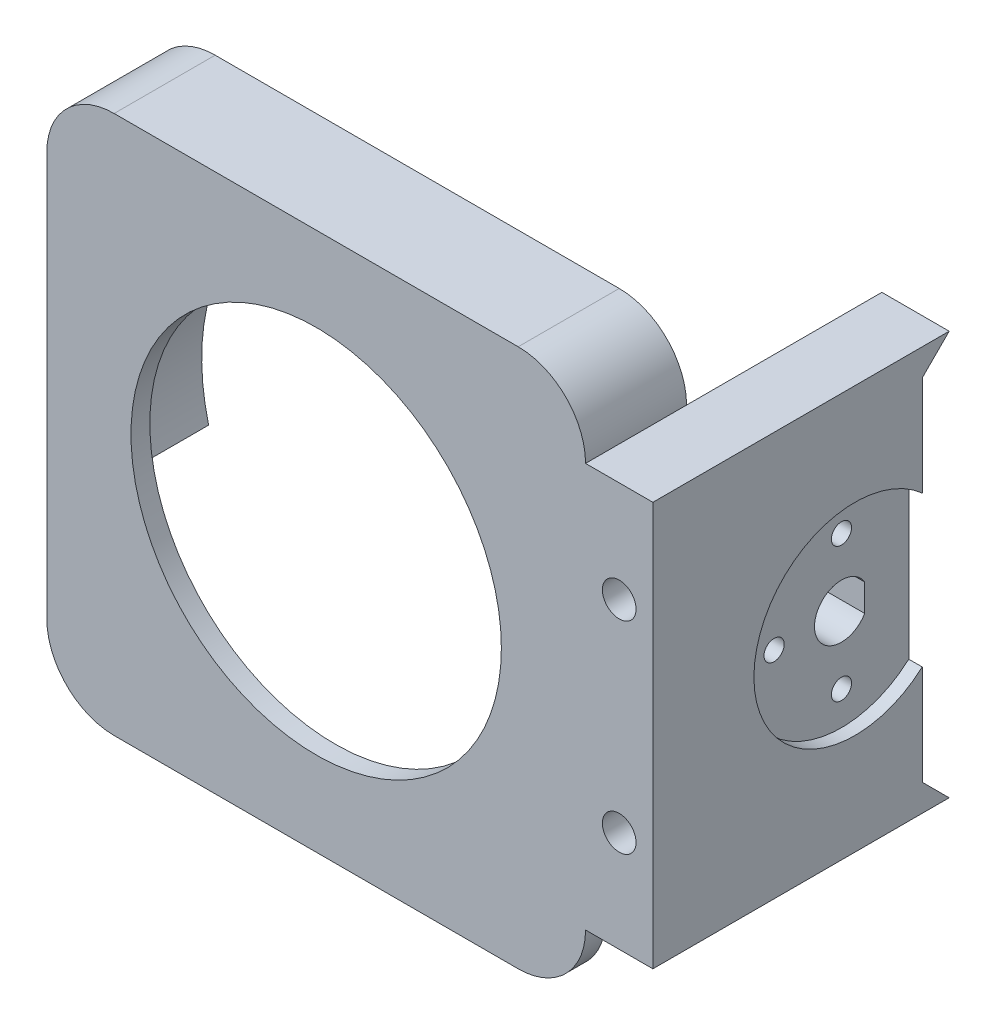
from build123d import *

# Parameters (mm, degrees)
SKETCH1_W           = 80
SKETCH1_H           = 80
SKETCH1_R           = 32
BOSS_EXTRUDE1_DEPTH = 15
BOSS_EXTRUDE2_START = -2.8
SKETCH2_R           = 32
SKETCH2_R_2         = 27.5
BOSS_EXTRUDE2_DEPTH = 2.8
FILLET1_R           = 10
SKETCH4_W           = 40
SKETCH4_H           = 60
BOSS_EXTRUDE3_DEPTH = 10
SKETCH10_R          = 2.5
CUT_EXTRUDE2_DEPTH  = 127.885775404
BOSS_EXTRUDE7_DEPTH = 10
CUT_EXTRUDE3_DEPTH  = 10
SKETCH13_R          = 1.5
CUT_EXTRUDE5_DEPTH  = 30
SKETCH14_R          = 15
CUT_EXTRUDE6_DEPTH  = 2
SKETCH16_W          = 60.967741935
SKETCH16_H          = 31.937806786
CUT_EXTRUDE10_DEPTH = 12
SKETCH17_W          = 80
SKETCH17_H          = 10
CUT_EXTRUDE11_DEPTH = 12
SKETCH18_R          = 2
CUT_EXTRUDE12_DEPTH = 20
CUT_EXTRUDE14_DEPTH = 12


with BuildPart() as part:
    # Sketch1 → Boss-Extrude1 (new body)
    with BuildSketch(Plane.XY):
        with Locations((40, 40)):
            Rectangle(SKETCH1_W, SKETCH1_H)
        with Locations((40, 40)):
            Circle(SKETCH1_R, mode=Mode.SUBTRACT)
    extrude(amount=BOSS_EXTRUDE1_DEPTH)

    # Sketch2 → Boss-Extrude2 (add)
    with BuildSketch(Plane.XY.offset(15).offset(BOSS_EXTRUDE2_START)):
        with Locations((40, 40)):
            Circle(SKETCH2_R)
        with Locations((40, 40)):
            Circle(SKETCH2_R_2, mode=Mode.SUBTRACT)
    extrude(amount=BOSS_EXTRUDE2_DEPTH)

    # Fillet1
    fillet1_edges = [part.edges().sort_by_distance(p)[0] for p in [
        (80, 0, 7.5),
        (0, 0, 7.5),
        (0, 80, 7.5),
        (80, 80, 7.5),
    ]]
    fillet(fillet1_edges, radius=FILLET1_R)

    # Sketch4 → Boss-Extrude3 (add)
    with BuildSketch(Plane(origin=(80, 0, 0), x_dir=(0, 0, -1), z_dir=(1, 0, 0))):
        with Locations((5, 40)):
            Rectangle(SKETCH4_W, SKETCH4_H)
    extrude(amount=BOSS_EXTRUDE3_DEPTH)

    # Sketch10 → Cut-Extrude2 (cut, through all)
    with BuildSketch(Plane(origin=(0, 0, -25), x_dir=(-1, 0, 0), z_dir=(0, 0, -1))):
        with Locations((-85, 55)):
            Circle(SKETCH10_R)
        with Locations((-85, 25)):
            Circle(SKETCH10_R)
    extrude(amount=-CUT_EXTRUDE2_DEPTH, mode=Mode.SUBTRACT)

    # Sketch11 → Boss-Extrude7 (add)
    with BuildSketch(Plane(origin=(90, 0, 0), x_dir=(0, 0, -1), z_dir=(1, 0, 0))):
        Polygon((25, 70), (25, 66), (29, 70), align=None)
        Polygon((25, 14), (29, 10), (25, 10), align=None)
    extrude(amount=-BOSS_EXTRUDE7_DEPTH)

    # Sketch12 → Cut-Extrude3 (cut)
    with BuildSketch(Plane(origin=(90, 0, 0), x_dir=(0, 0, -1), z_dir=(1, 0, 0))):
        with BuildLine():
            Line((18.45172909, 42.02127838), (18.45172909, 37.97872162))
            ThreePointArc((18.45172909, 37.97872162), (11, 40), (18.45172909, 42.02127838))
        make_face()
    extrude(amount=-CUT_EXTRUDE3_DEPTH, mode=Mode.SUBTRACT)

    # Sketch13 → Cut-Extrude5 (cut)
    with BuildSketch(Plane(origin=(90, 0, 0), x_dir=(0, 0, -1), z_dir=(1, 0, 0))):
        with Locations((15, 50)):
            Circle(SKETCH13_R)
        with Locations((15, 30)):
            Circle(SKETCH13_R)
        with Locations((5, 40)):
            Circle(SKETCH13_R)
    extrude(amount=-CUT_EXTRUDE5_DEPTH, mode=Mode.SUBTRACT)

    # Sketch14 → Cut-Extrude6 (cut)
    with BuildSketch(Plane(origin=(90, 0, 0), x_dir=(0, 0, -1), z_dir=(1, 0, 0))):
        with Locations((15, 40)):
            Circle(SKETCH14_R)
    extrude(amount=-CUT_EXTRUDE6_DEPTH, mode=Mode.SUBTRACT)

    # Sketch16 → Cut-Extrude10 (cut)
    with BuildSketch(Plane(origin=(0, 0, 0), x_dir=(-1, 0, 0), z_dir=(0, 0, -1))):
        with Locations((-39.516129033, 15.968903393)):
            Rectangle(SKETCH16_W, SKETCH16_H)
    extrude(amount=-CUT_EXTRUDE10_DEPTH, mode=Mode.SUBTRACT)

    # Sketch17 → Cut-Extrude11 (cut)
    with BuildSketch(Plane(origin=(0, 0, 0), x_dir=(-1, 0, 0), z_dir=(0, 0, -1))):
        with Locations((-40, 5)):
            Rectangle(SKETCH17_W, SKETCH17_H)
    extrude(amount=-CUT_EXTRUDE11_DEPTH, mode=Mode.SUBTRACT)

    # Sketch18 → Cut-Extrude12 (cut)
    with BuildSketch(Plane.XZ.offset(-10)):
        with Locations((5, 6)):
            Circle(SKETCH18_R)
        with Locations((75, 6)):
            Circle(SKETCH18_R)
    extrude(amount=-CUT_EXTRUDE12_DEPTH, mode=Mode.SUBTRACT)

    # Sketch21 → Cut-Extrude14 (cut)
    with BuildSketch(Plane(origin=(0, 0, 0), x_dir=(-1, 0, 0), z_dir=(0, 0, -1))):
        Polygon((0, 31.937806786), (-70.967741935, 31.937806786), (-80, 31.937806786), (-80, 0), (0, 0), align=None)
    extrude(amount=-CUT_EXTRUDE14_DEPTH, mode=Mode.SUBTRACT)


solid = part.part
